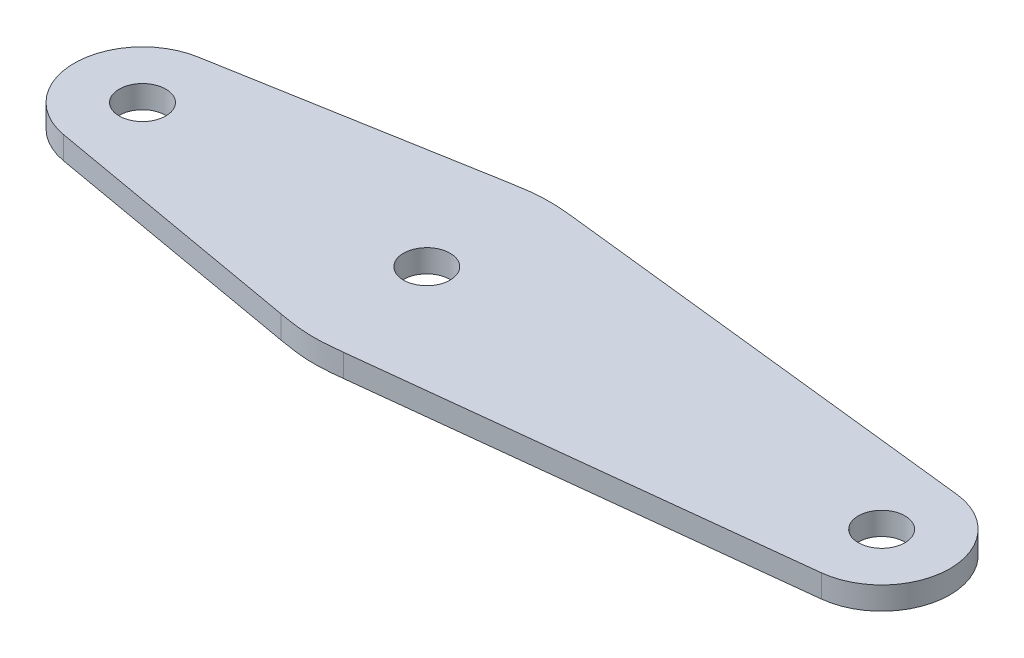
from build123d import *

# Parameters (mm, degrees)
SKETCH_1_R      = 4.1
EXTRUDE_1_DEPTH = 4


with BuildPart() as part:
    # 草图1 → 凸台-拉伸1 (new body)
    with BuildSketch(Plane(origin=(0, 0, 0), x_dir=(1, 0, 0), z_dir=(0, 1, 0))):
        with BuildLine():
            Line((-2.083455003, 11.817750008), (50, 21))
            Line((50, 21), (131.330576007, 11.926003836))
            ThreePointArc((131.330576007, 11.926003836), (142, 0), (131.330576007, -11.926003836))
            Line((131.330576007, -11.926003836), (50, -21))
            Line((50, -21), (-2.083455003, -11.817750008))
            ThreePointArc((-2.083455003, -11.817750008), (-12, 0), (-2.083455003, 11.817750008))
        make_face()
        with Locations(Location((0, 0, 0), (0, 0, 270))):
            Circle(SKETCH_1_R, mode=Mode.SUBTRACT)
        with Locations(Location((50, 0, 0), (0, 0, 270))):
            Circle(SKETCH_1_R, mode=Mode.SUBTRACT)
        with Locations(Location((130, 0, 0), (0, 0, 270))):
            Circle(SKETCH_1_R, mode=Mode.SUBTRACT)
    extrude(amount=EXTRUDE_1_DEPTH)

    # 圆角1
    # a fillet whose section is not a circle: 40 mm, written as the material it takes off along each edge
    with BuildSketch(Plane(origin=(50, -14.378648939, 21), x_dir=(0.9938336529777407, 0, -0.11088133390665686), z_dir=(0, 1, 0)), Plane(origin=(50, -14.378648939, -21), x_dir=(-0.9848125006580993, 0, 0.17362125027640163), z_dir=(0, 1, 0))) as fillet_1_piece_1:
        with BuildLine():
            add(Edge.make_bspline([(5.751459576, 0), (4.676371086, 0), (3.601282597, 0), (1.210344489, 0.06897002), (-1.141879394, 0.407188034), (-3.455389054, 1.014654044), (-4.486924042, 1.317558038), (-5.518459029, 1.620462032)], knots=[0, 0, 0, 0, 0, 0, 0.5, 0.5, 1, 1, 1, 1, 1, 1], degree=5))
            Line((-5.518459029, 1.620462032), (0, 0))
            Line((0, 0), (5.751459576, 0))
        make_face()
    extrude(amount=32.757297879, mode=Mode.SUBTRACT)


solid = part.part
